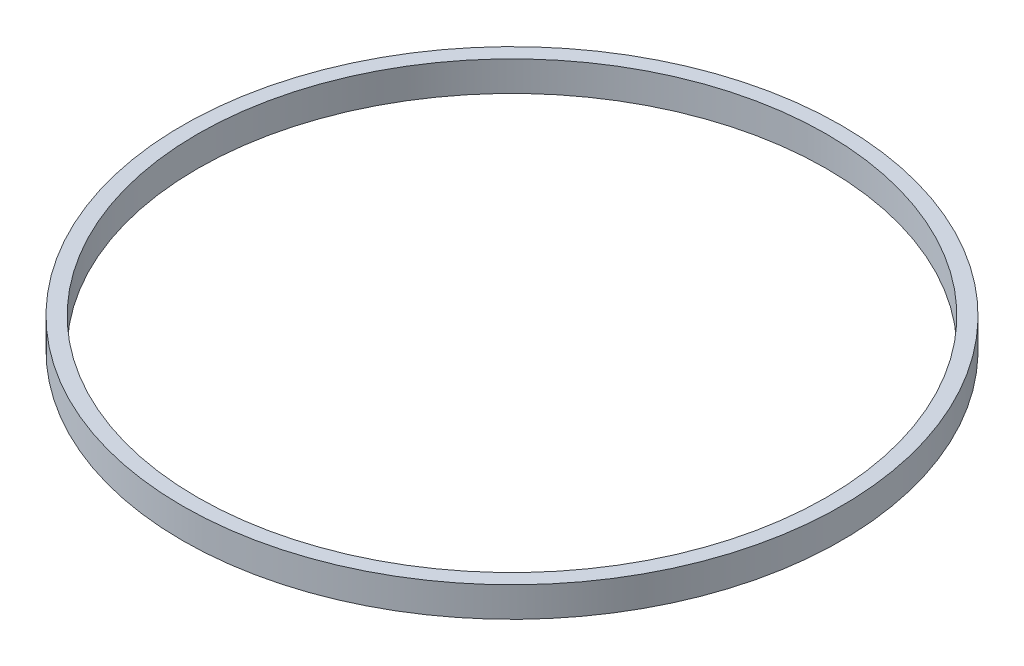
from build123d import *

# Parameters (mm, degrees)
SKETCH2_R           = 33
SKETCH2_R_2         = 31.5
BOSS_EXTRUDE1_DEPTH = 3


with BuildPart() as part:
    # Sketch2 → Boss-Extrude1 (new body)
    with BuildSketch(Plane(origin=(0, 0, 0), x_dir=(1, 0, 0), z_dir=(0, 1, 0))):
        Circle(SKETCH2_R)
        Circle(SKETCH2_R_2, mode=Mode.SUBTRACT)
    extrude(amount=BOSS_EXTRUDE1_DEPTH)


solid = part.part
